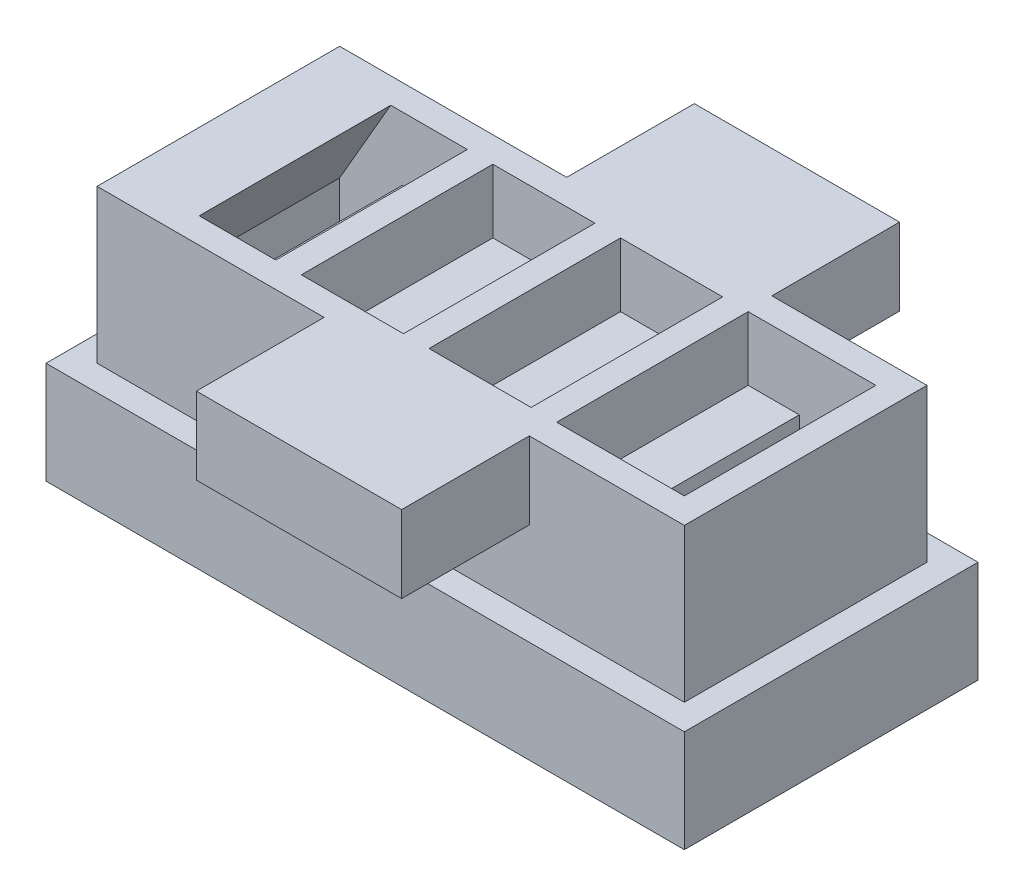
from build123d import *

# Parameters (mm, degrees)
BOSS_EXTRUDE1_DEPTH      = 7.5
BOSS_EXTRUDE1_DEPTH_BACK = 7.5
CUT_EXTRUDE1_DEPTH       = 5.5
CUT_EXTRUDE1_DEPTH_BACK  = 5.5
SKETCH2_W                = 4
SKETCH2_H                = 12
SKETCH3_W                = 34
SKETCH3_H                = 2
CUT_EXTRUDE2_DEPTH       = 2
BOSS_EXTRUDE2_DEPTH      = 15
BOSS_EXTRUDE2_DEPTH_BACK = 5
SKETCH4_W                = 46
SKETCH4_H                = 19
SPLIT1_START             = -5
SPLIT1_OUTLINE_W         = 46
SPLIT1_OUTLINE_H         = 19
SPLIT1_DEPTH             = 5
SPLIT1_2_OUTLINE_W       = 4
SPLIT1_2_OUTLINE_H       = 11
SPLIT1_2_DEPTH           = 12
SPLIT1_3_OUTLINE_W       = 6
SPLIT1_3_OUTLINE_H       = 2
SPLIT1_3_DEPTH           = 2
SPLIT1_START_2           = -5.5
SPLIT1_4_DEPTH           = 11
SPLIT1_START_3           = -9.5
SPLIT1_5_OUTLINE_W       = 46
SPLIT1_5_OUTLINE_H       = 5
SPLIT1_5_DEPTH           = 19
SPLIT1_START_4           = -1
SPLIT1_6_OUTLINE_W       = 6
SPLIT1_6_OUTLINE_H       = 2
SPLIT1_6_DEPTH           = 2
SKETCH5_W                = 16.073439162
SKETCH5_H                = 6.039622656
BOSS_EXTRUDE3_DEPTH      = 10
SKETCH6_W                = 50
SKETCH6_H                = 23
SKETCH6_W_2              = 46
SKETCH6_H_2              = 19
BOSS_EXTRUDE4_DEPTH      = 8


# Read off the part's stored shape, not the designer's step: Split1
with BuildPart() as part:
    # Sketch1 → Boss-Extrude1 (new, two sides: drawn at the far end of the back side and taken through both)
    with BuildSketch(Plane.XY.offset(-BOSS_EXTRUDE1_DEPTH_BACK)):
        Polygon((-21, 0), (21, 0), (21, 15), (11, 15), (11, 4), (9, 4), (9, 15), (1, 15), (1, 4), (-1, 4), (-1, 15), (-9, 15), (-9, 4), (-11, 4), (-11, 15), (-17, 15), (-21, 8.07179677), align=None)
    extrude(amount=BOSS_EXTRUDE1_DEPTH + BOSS_EXTRUDE1_DEPTH_BACK)

    # Sketch2 → Cut-Extrude1 (cut, two sides: drawn at the far end of the back side and taken through both)
    with BuildSketch(Plane.XY.offset(-CUT_EXTRUDE1_DEPTH_BACK)):
        with Locations((15, 6)):
            Rectangle(SKETCH2_W, SKETCH2_H)
        Polygon((-13, 12), (-13, 0), (-17, 0), (-17, 7), (-14.113248654, 12), align=None)
        with Locations((-5, 6)):
            Rectangle(SKETCH2_W, SKETCH2_H)
        with Locations((5, 6)):
            Rectangle(SKETCH2_W, SKETCH2_H)
    extrude(amount=CUT_EXTRUDE1_DEPTH + CUT_EXTRUDE1_DEPTH_BACK, mode=Mode.SUBTRACT)

    # Sketch3 → Cut-Extrude2 (cut)
    with BuildSketch(Plane(origin=(0, 0, 0), x_dir=(-1, 0, 0), z_dir=(0, -1, 0))):
        Rectangle(SKETCH3_W, SKETCH3_H)
    extrude(amount=-CUT_EXTRUDE2_DEPTH, mode=Mode.SUBTRACT)


with BuildPart() as body_2:
    # Sketch4 → Boss-Extrude2 (new, two sides: drawn at the far end of the back side and taken through both)
    with BuildSketch(Plane(origin=(0, 0, 0), x_dir=(1, 0, 0), z_dir=(0, 1, 0)).offset(-BOSS_EXTRUDE2_DEPTH_BACK)):
        Rectangle(SKETCH4_W, SKETCH4_H)
    extrude(amount=BOSS_EXTRUDE2_DEPTH + BOSS_EXTRUDE2_DEPTH_BACK)

    # Combine1: cut part
    add(part.part, mode=Mode.SUBTRACT)

    # Split1 outline → Split1 (cut)
    with BuildSketch(Plane(origin=(0, 0, 0), x_dir=(1, 0, 0), z_dir=(0, 1, 0)).offset(SPLIT1_START)):
        Rectangle(SPLIT1_OUTLINE_W, SPLIT1_OUTLINE_H)
    extrude(amount=SPLIT1_DEPTH, mode=Mode.SUBTRACT)

    # Split1 2 outline → Split1 2 (cut)
    with BuildSketch(Plane(origin=(0, 0, 0), x_dir=(1, 0, 0), z_dir=(0, 1, 0))):
        with Locations((-15, 0)):
            Rectangle(SPLIT1_2_OUTLINE_W, SPLIT1_2_OUTLINE_H)
        with Locations((-5, 0)):
            Rectangle(SPLIT1_2_OUTLINE_W, SPLIT1_2_OUTLINE_H)
        with Locations((5, 0)):
            Rectangle(SPLIT1_2_OUTLINE_W, SPLIT1_2_OUTLINE_H)
        with Locations((15, 0)):
            Rectangle(SPLIT1_2_OUTLINE_W, SPLIT1_2_OUTLINE_H)
    extrude(amount=SPLIT1_2_DEPTH, mode=Mode.SUBTRACT)

    # Split1 3 outline → Split1 3 (cut)
    with BuildSketch(Plane(origin=(0, 0, 0), x_dir=(1, 0, 0), z_dir=(0, 1, 0))):
        with Locations((-10, 0)):
            Rectangle(SPLIT1_3_OUTLINE_W, SPLIT1_3_OUTLINE_H)
        Rectangle(SPLIT1_3_OUTLINE_W, SPLIT1_3_OUTLINE_H)
        with Locations((10, 0)):
            Rectangle(SPLIT1_3_OUTLINE_W, SPLIT1_3_OUTLINE_H)
    extrude(amount=SPLIT1_3_DEPTH, mode=Mode.SUBTRACT)

    # Sketch5 → Boss-Extrude3 (add)
    with BuildSketch(Plane.XY.offset(9.5)):
        with Locations((2.818305229, 11.980188672)):
            Rectangle(SKETCH5_W, SKETCH5_H)
    boss_extrude3 = extrude(amount=BOSS_EXTRUDE3_DEPTH)

    # Mirror1: Boss-Extrude3 across plane
    add(boss_extrude3.mirror(Plane.XY))


with BuildPart() as body_2_2:
    # Split1 4 outline → Split1 4 (new body)
    with BuildSketch(Plane.XY.offset(SPLIT1_START_2)):
        Polygon((17, 0), (17, 12), (13, 12), (13, 0), (7, 0), (7, 12), (3, 12), (3, 0), (-3, 0), (-3, 12), (-7, 12), (-7, 0), (-13, 0), (-13, 12), (-14.113248654, 12), (-17, 7), (-17, 0), (-23, 0), (-23, -5), (23, -5), (23, 0), align=None)
    extrude(amount=SPLIT1_4_DEPTH)

    # Split1 5 outline → Split1 5 (add)
    with BuildSketch(Plane.XY.offset(SPLIT1_START_3)):
        with Locations((0, -2.5)):
            Rectangle(SPLIT1_5_OUTLINE_W, SPLIT1_5_OUTLINE_H)
    extrude(amount=SPLIT1_5_DEPTH)

    # Split1 6 outline → Split1 6 (add)
    with BuildSketch(Plane.XY.offset(SPLIT1_START_4)):
        with Locations((10, 1)):
            Rectangle(SPLIT1_6_OUTLINE_W, SPLIT1_6_OUTLINE_H)
        with Locations((0, 1)):
            Rectangle(SPLIT1_6_OUTLINE_W, SPLIT1_6_OUTLINE_H)
        with Locations((-10, 1)):
            Rectangle(SPLIT1_6_OUTLINE_W, SPLIT1_6_OUTLINE_H)
    extrude(amount=SPLIT1_6_DEPTH)


with BuildPart() as body_3:
    # Sketch6 → Boss-Extrude4 (new body)
    with BuildSketch(Plane.XZ.offset(5)):
        Rectangle(SKETCH6_W, SKETCH6_H)
        Rectangle(SKETCH6_W_2, SKETCH6_H_2, mode=Mode.SUBTRACT)
    extrude(amount=-BOSS_EXTRUDE4_DEPTH)


with BuildPart() as body_2_2_1:
    add(body_2_2.part)

    # Combine2: union body 3
    add(body_3.part)


solid = Compound([body_2.part, body_2_2_1.part])
